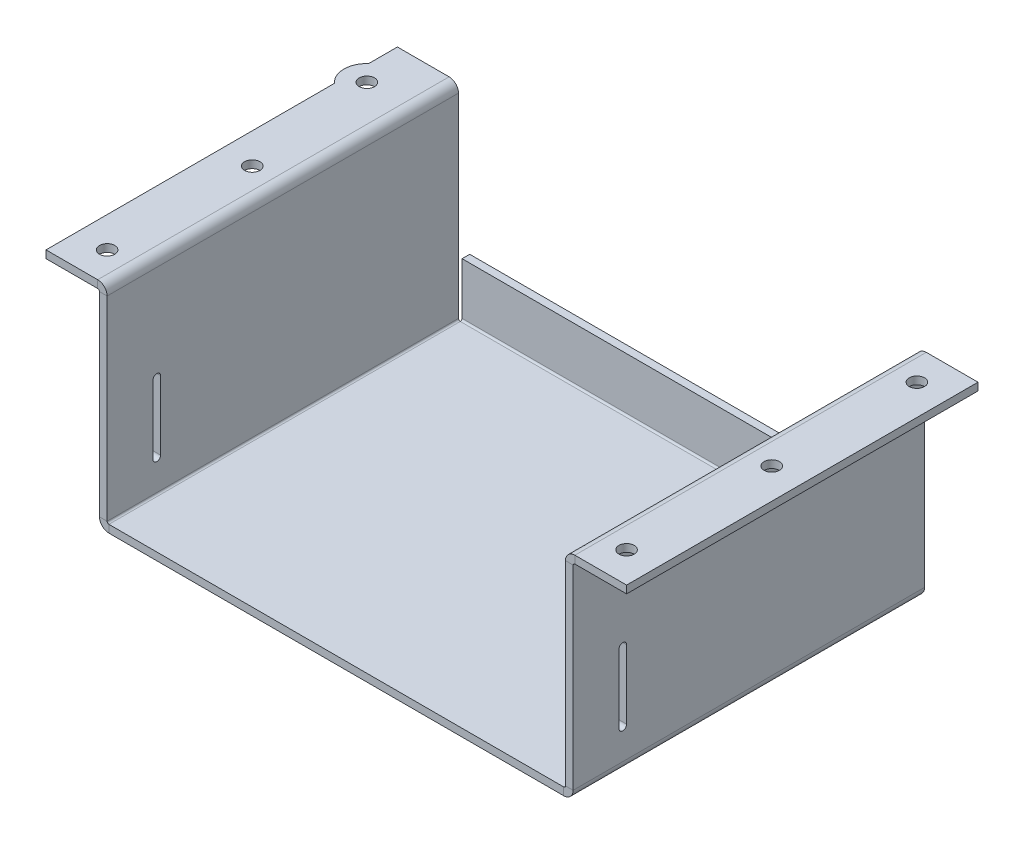
from build123d import *

# Parameters (mm, degrees)
BASE_FLANGE1_DEPTH      = 146.05
EDGE_FLANGE1_DEPTH      = 189.0268
SKETCH9_R               = 3.175
CUT_EXTRUDE1_DEPTH      = 210.261164577
CUT_EXTRUDE2_DEPTH      = 208.932201991
CUT_EXTRUDE2_DEPTH_BACK = 208.932201991
TAB1_START              = -3.175
SKETCH15_R              = 9.525
SKETCH15_R_2            = 3.175
TAB1_DEPTH              = 3.175


# Sheet-metal steps are written as plain solids
with BuildPart() as part:
    # Sketch1 → Base-Flange1 (new body)
    with BuildSketch(Plane.XY):
        with BuildLine():
            Line((120.65, 85.725), (99.1616, 85.725))
            ThreePointArc((99.1616, 85.725), (96.395681115, 84.579318885), (95.25, 81.8134))
            Line((95.25, 81.8134), (95.25, 0.7366))
            ThreePointArc((95.25, 0.7366), (95.034254855, 0.215745145), (94.5134, 0))
            Line((94.5134, 0), (-94.5134, 0))
            ThreePointArc((-94.5134, 0), (-95.034254855, 0.215745145), (-95.25, 0.7366))
            Line((-95.25, 0.7366), (-95.25, 81.8134))
            ThreePointArc((-95.25, 81.8134), (-96.395681115, 84.579318885), (-99.1616, 85.725))
            Line((-99.1616, 85.725), (-120.65, 85.725))
            Line((-120.65, 85.725), (-120.65, 82.55))
            Line((-120.65, 82.55), (-99.1616, 82.55))
            ThreePointArc((-99.1616, 82.55), (-98.640745145, 82.334254855), (-98.425, 81.8134))
            Line((-98.425, 81.8134), (-98.425, 0.7366))
            ThreePointArc((-98.425, 0.7366), (-97.279318885, -2.029318885), (-94.5134, -3.175))
            Line((-94.5134, -3.175), (94.5134, -3.175))
            ThreePointArc((94.5134, -3.175), (97.279318885, -2.029318885), (98.425, 0.7366))
            Line((98.425, 0.7366), (98.425, 81.8134))
            ThreePointArc((98.425, 81.8134), (98.640745145, 82.334254855), (99.1616, 82.55))
            Line((99.1616, 82.55), (120.65, 82.55))
            Line((120.65, 82.55), (120.65, 85.725))
        make_face()
    extrude(amount=BASE_FLANGE1_DEPTH)

    # Edge-Flange1 section (across the edge) → Edge-Flange1 (add)
    with BuildSketch(Plane(origin=(94.5134, 0, -0.7366), x_dir=(0, 0, 1), z_dir=(-1, 0, 0))):
        with BuildLine():
            Line((-3.175, 0.7366), (-3.175, 22.225))
            Line((-3.175, 22.225), (0, 22.225))
            Line((0, 22.225), (0, 0.7366))
            ThreePointArc((0, 0.7366), (0.215745145, 0.215745145), (0.7366, 0))
            Line((0.7366, 0), (0.7366, -3.175))
            ThreePointArc((0.7366, -3.175), (-2.029318885, -2.029318885), (-3.175, 0.7366))
        make_face()
    extrude(amount=EDGE_FLANGE1_DEPTH)

    # Sketch9 → Cut-Extrude1 (cut, through all)
    with BuildSketch(Plane(origin=(0, 85.725, 0), x_dir=(1, 0, 0), z_dir=(0, 1, 0))):
        with Locations(Location((-114.3, -19.05, 0), (0, 0, 180))):
            Circle(SKETCH9_R)
        with Locations(Location((-107.95, -73.025, 0), (0, 0, 180))):
            Circle(SKETCH9_R)
        with Locations(Location((-107.95, -133.35, 0), (0, 0, 180))):
            Circle(SKETCH9_R)
        with Locations(Location((107.95, -133.35, 0), (0, 0, 180))):
            Circle(SKETCH9_R)
        with Locations(Location((107.95, -73.025, 0), (0, 0, 180))):
            Circle(SKETCH9_R)
        with Locations(Location((107.95, -12.7, 0), (0, 0, 180))):
            Circle(SKETCH9_R)
    extrude(amount=-CUT_EXTRUDE1_DEPTH, mode=Mode.SUBTRACT)

    # Sketch14 → Cut-Extrude2 (cut, two sides: drawn at the far end of the back side and taken through both)
    with BuildSketch(Plane(origin=(0, 0, 0), x_dir=(0, 1, 0), z_dir=(-1, 0, 0)).offset(-CUT_EXTRUDE2_DEPTH_BACK)):
        with BuildLine():
            Line((42.0116, -127), (13.4366, -127))
            ThreePointArc((13.4366, -127), (11.8491, -125.4125), (13.4366, -123.825))
            Line((13.4366, -123.825), (42.0116, -123.825))
            ThreePointArc((42.0116, -123.825), (43.5991, -125.4125), (42.0116, -127))
        make_face()
    extrude(amount=CUT_EXTRUDE2_DEPTH + CUT_EXTRUDE2_DEPTH_BACK, mode=Mode.SUBTRACT)

    # Sketch15 → Tab1 (add)
    with BuildSketch(Plane.XZ.offset(-82.55).offset(TAB1_START)):
        with Locations((-114.3, 19.05)):
            Circle(SKETCH15_R)
        with Locations(Location((-114.3, 19.05, 0), (0, 0, 180))):
            Circle(SKETCH15_R_2, mode=Mode.SUBTRACT)
    extrude(amount=TAB1_DEPTH)


solid = part.part
